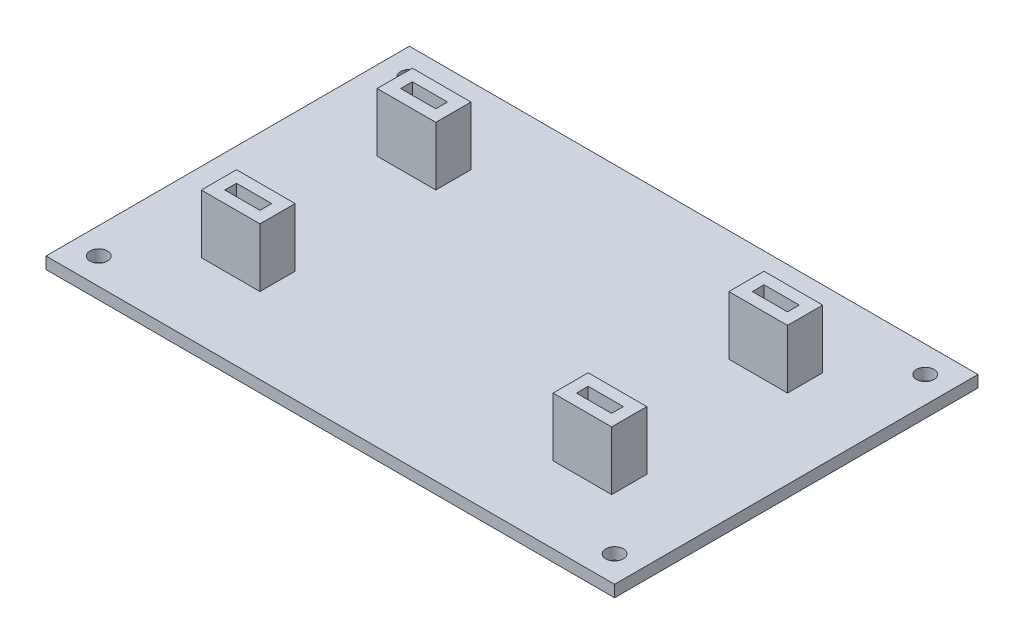
from build123d import *

# Parameters (mm, degrees)
SKETCH_1_W            = 97
SKETCH_1_H            = 62
EXTRUDE_389_DEPTH     = 2
SKETCH_2_R            = 1.5
CUT_EXTRUDE_652_DEPTH = 2
SKETCH_3_W            = 10
SKETCH_3_H            = 6
SKETCH_3_W_2          = 6
SKETCH_3_H_2          = 2
EXTRUDE_2551_DEPTH    = 10


with BuildPart() as part:
    # 草图1 → Extrude 389 (new body)
    with BuildSketch(Plane(origin=(0, 0, 0), x_dir=(1, 0, 0), z_dir=(0, 1, 0))):
        Rectangle(SKETCH_1_W, SKETCH_1_H)
    extrude(amount=EXTRUDE_389_DEPTH)

    # 草图2 → Cut-Extrude 652 (cut)
    with BuildSketch(Plane(origin=(0, 2, 0), x_dir=(1, 0, 0), z_dir=(0, 1, 0))):
        with Locations((-44, 26.5)):
            Circle(SKETCH_2_R)
        with Locations((44, 26.5)):
            Circle(SKETCH_2_R)
        with Locations((-44, -26.5)):
            Circle(SKETCH_2_R)
        with Locations((44, -26.5)):
            Circle(SKETCH_2_R)
    extrude(amount=-CUT_EXTRUDE_652_DEPTH, mode=Mode.SUBTRACT)

    # 草图3 → Extrude 2551 (add)
    # profile 1 of 4: a face of its own
    with BuildSketch(Plane(origin=(0, 2, 0), x_dir=(1, 0, 0), z_dir=(0, 1, 0))):
        with Locations((30, 15)):
            Rectangle(SKETCH_3_W, SKETCH_3_H)
        with Locations((30, 15)):
            Rectangle(SKETCH_3_W_2, SKETCH_3_H_2, mode=Mode.SUBTRACT)
    # profile 2 of 4: a face of its own
    with BuildSketch(Plane(origin=(0, 2, 0), x_dir=(1, 0, 0), z_dir=(0, 1, 0))):
        with Locations((-30, 15)):
            Rectangle(SKETCH_3_W, SKETCH_3_H)
        with Locations((-30, 15)):
            Rectangle(SKETCH_3_W_2, SKETCH_3_H_2, mode=Mode.SUBTRACT)
    # profile 3 of 4: a face of its own
    with BuildSketch(Plane(origin=(0, 2, 0), x_dir=(1, 0, 0), z_dir=(0, 1, 0))):
        with Locations((30, -15)):
            Rectangle(SKETCH_3_W, SKETCH_3_H)
        with Locations((30, -15)):
            Rectangle(SKETCH_3_W_2, SKETCH_3_H_2, mode=Mode.SUBTRACT)
    # profile 4 of 4: a face of its own
    with BuildSketch(Plane(origin=(0, 2, 0), x_dir=(1, 0, 0), z_dir=(0, 1, 0))):
        with Locations((-30, -15)):
            Rectangle(SKETCH_3_W, SKETCH_3_H)
        with Locations((-30, -15)):
            Rectangle(SKETCH_3_W_2, SKETCH_3_H_2, mode=Mode.SUBTRACT)
    extrude(amount=EXTRUDE_2551_DEPTH)


solid = part.part
